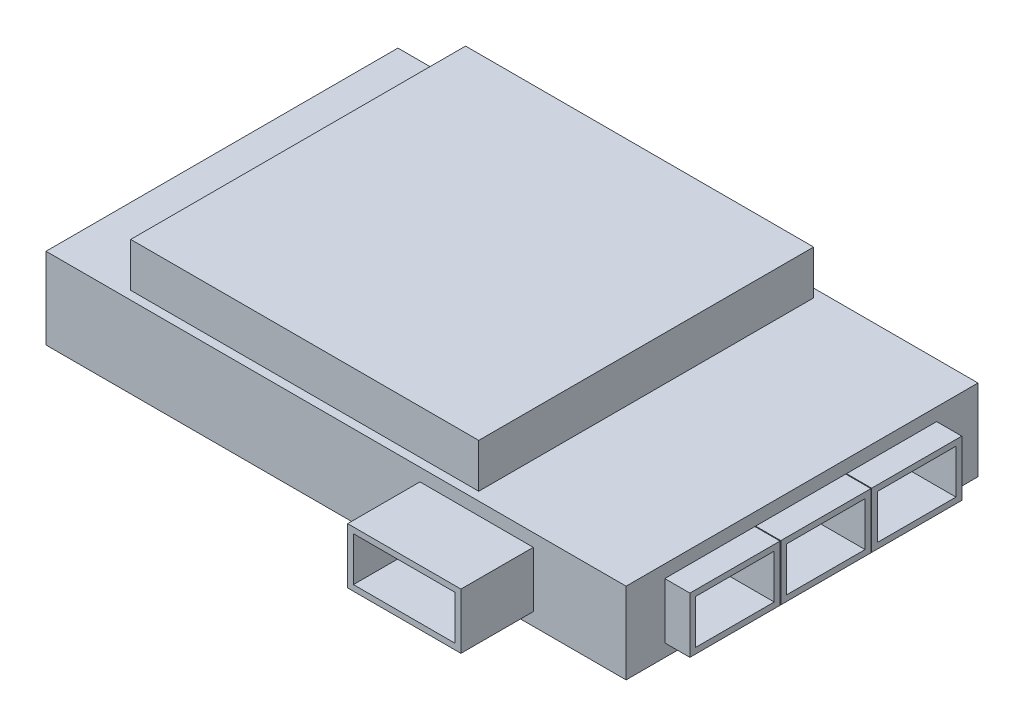
from build123d import *

# Parameters (mm, degrees)
SKETCH1_W           = 38.1
SKETCH1_H           = 23.114
BOSS_EXTRUDE1_DEPTH = 5.334
SKETCH2_W           = 22.86
SKETCH2_H           = 21.9964
BOSS_EXTRUDE2_DEPTH = 2.8956
BOSS_EXTRUDE3_DEPTH = 4.7498
CUT_EXTRUDE1_DEPTH  = 3.556
SKETCH5_W           = 5.9182
SKETCH5_H           = 3.6576
BOSS_EXTRUDE4_DEPTH = 1.651
SKETCH6_W           = 5.1562
SKETCH6_H           = 2.8956
CUT_EXTRUDE2_DEPTH  = 3.3782
LPATTERN1_COUNT     = 3
LPATTERN1_PITCH     = 5.969


with BuildPart() as part:
    # Sketch1 → Boss-Extrude1 (new body)
    with BuildSketch(Plane(origin=(0, 0, 0), x_dir=(1, 0, 0), z_dir=(0, 1, 0))):
        with Locations((19.05, 11.557)):
            Rectangle(SKETCH1_W, SKETCH1_H)
    extrude(amount=BOSS_EXTRUDE1_DEPTH)

    # Sketch2 → Boss-Extrude2 (add)
    with BuildSketch(Plane(origin=(0, 5.334, 0), x_dir=(1, 0, 0), z_dir=(0, 1, 0))):
        with Locations((16.4338, 11.557)):
            Rectangle(SKETCH2_W, SKETCH2_H)
    extrude(amount=BOSS_EXTRUDE2_DEPTH)

    # Sketch3 → Boss-Extrude3 (add)
    with BuildSketch(Plane.XY):
        Polygon((27.243949485, 4.4958), (24.5618, 4.4958), (24.5618, 0.8382), (27.368734438, 0.8382), (32.004, 0.8382), (32.004, 4.4958), align=None)
    extrude(amount=BOSS_EXTRUDE3_DEPTH)

    # Sketch4 → Cut-Extrude1 (cut)
    with BuildSketch(Plane.XY.offset(4.7498)):
        Polygon((31.623, 4.1148), (24.9428, 4.1148), (24.9428, 2.565312431), (24.9428, 1.2192), (28.02695431, 1.2192), (31.623, 1.2192), (31.623, 2.565312431), align=None)
    extrude(amount=-CUT_EXTRUDE1_DEPTH, mode=Mode.SUBTRACT)

    # Sketch5 → Boss-Extrude4 (add)
    with BuildSketch(Plane(origin=(38.1, 0, 0), x_dir=(0, 0, -1), z_dir=(1, 0, 0))):
        with Locations((5.4991, 2.667)):
            Rectangle(SKETCH5_W, SKETCH5_H)
    boss_extrude4 = extrude(amount=BOSS_EXTRUDE4_DEPTH)

    # Sketch6 → Cut-Extrude2 (cut)
    with BuildSketch(Plane(origin=(39.751, 0, 0), x_dir=(0, 0, -1), z_dir=(1, 0, 0))):
        with Locations((5.4991, 2.667)):
            Rectangle(SKETCH6_W, SKETCH6_H)
    cut_extrude2 = extrude(amount=-CUT_EXTRUDE2_DEPTH, mode=Mode.SUBTRACT)

    # LPattern1: Boss-Extrude4, Cut-Extrude2 ×3
    with Locations(*[(0, 0, -i * LPATTERN1_PITCH) for i in range(1, LPATTERN1_COUNT)]):
        add(boss_extrude4)
        add(cut_extrude2, mode=Mode.SUBTRACT)


solid = part.part
